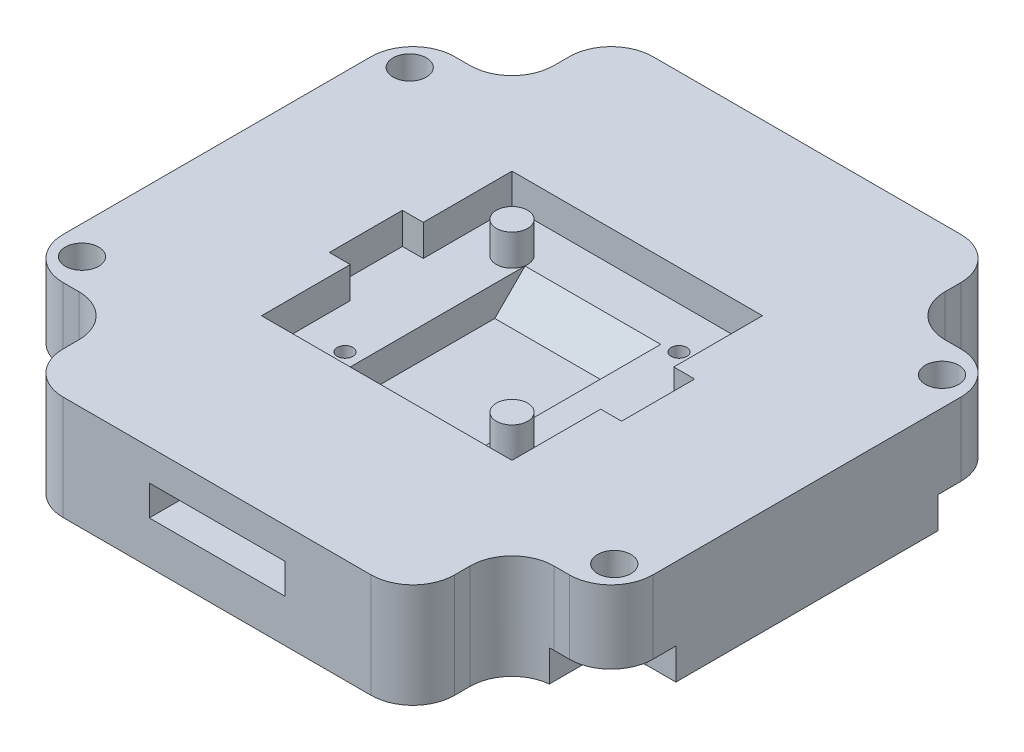
from build123d import *

# Parameters (mm, degrees)
AUFSATZ_LINEAR_AUSTRAGEN1_DEPTH      = 10
SKIZZE2_W                            = 24
SKIZZE2_H                            = 24
SCHNITT_LINEAR_AUSTRAGEN1_DEPTH      = 3
VERRUNDUNG1_R                        = 4
SKIZZE3_R                            = 1.5
AUFSATZ_LINEAR_AUSTRAGEN2_DEPTH      = 3
SKIZZE4_W                            = 2
SKIZZE4_H                            = 7
SCHNITT_LINEAR_AUSTRAGEN2_DEPTH      = 3
SKIZZE5_W                            = 13
SKIZZE5_H                            = 2.9
SCHNITT_LINEAR_AUSTRAGEN3_DEPTH      = 32
FASE1_SIZE                           = 4
F_3_2_3_2_DURCHMESSER_BOHRUNG1_D     = 3.2
F_3_2_3_2_DURCHMESSER_BOHRUNG1_DEPTH = 11
F_3_2_3_2_DURCHMESSER_BOHRUNG1_TIP   = 0.96137699
F_1_5_1_5_DURCHMESSER_BOHRUNG1_D     = 1.5
F_1_5_1_5_DURCHMESSER_BOHRUNG1_DEPTH = 5
F_1_5_1_5_DURCHMESSER_BOHRUNG1_TIP   = 0.450645464
SCHNITT_LINEAR_AUSTRAGEN4_DEPTH      = 3
SPIEGELN3_COPY_1_DEPTH               = 3


with BuildPart() as part:
    # Skizze1 → Aufsatz-Linear austragen1 (new body)
    with BuildSketch(Plane(origin=(0, 0, 0), x_dir=(1, 0, 0), z_dir=(0, 1, 0))):
        Polygon((18.75, 18.75), (28.25, 18.75), (28.25, -18.75), (18.75, -18.75), (18.75, -28.25), (-18.75, -28.25), (-18.75, -18.75), (-28.25, -18.75), (-28.25, 18.75), (-18.75, 18.75), (-18.75, 28.25), (18.75, 28.25), align=None)
    extrude(amount=AUFSATZ_LINEAR_AUSTRAGEN1_DEPTH)

    # Skizze2 → Schnitt-Linear austragen1 (cut)
    with BuildSketch(Plane(origin=(0, 10, 0), x_dir=(1, 0, 0), z_dir=(0, 1, 0))):
        Rectangle(SKIZZE2_W, SKIZZE2_H)
    extrude(amount=-SCHNITT_LINEAR_AUSTRAGEN1_DEPTH, mode=Mode.SUBTRACT)

    # Verrundung1
    verrundung1_edges = [part.edges().sort_by_distance(p)[0] for p in [
        (18.75, 5, 18.75),
        (18.75, 5, 28.25),
        (-18.75, 5, 28.25),
        (-18.75, 5, 18.75),
        (-28.25, 5, 18.75),
        (-28.25, 5, -18.75),
        (-18.75, 5, -18.75),
        (-18.75, 5, -28.25),
        (18.75, 5, -28.25),
        (18.75, 5, -18.75),
        (28.25, 5, -18.75),
        (28.25, 5, 18.75),
    ]]
    fillet(verrundung1_edges, radius=VERRUNDUNG1_R)

    # Skizze3 → Aufsatz-Linear austragen2 (add)
    with BuildSketch(Plane(origin=(0, 7, 0), x_dir=(1, 0, 0), z_dir=(0, 1, 0))):
        with Locations(Location((-8, 8, 0), (0, 0, 270))):
            Circle(SKIZZE3_R)
        with Locations(Location((8, -8, 0), (0, 0, 270))):
            Circle(SKIZZE3_R)
    extrude(amount=AUFSATZ_LINEAR_AUSTRAGEN2_DEPTH)

    # Skizze4 → Schnitt-Linear austragen2 (cut)
    with BuildSketch(Plane(origin=(0, 10, 0), x_dir=(1, 0, 0), z_dir=(0, 1, 0))):
        with Locations((13, 0)):
            Rectangle(SKIZZE4_W, SKIZZE4_H)
    schnitt_linear_austragen2 = extrude(amount=-SCHNITT_LINEAR_AUSTRAGEN2_DEPTH, mode=Mode.SUBTRACT)

    # Spiegeln1: Schnitt-Linear austragen2 across plane
    add(schnitt_linear_austragen2.mirror(Plane(origin=(0, 0, 0), x_dir=(0, 0, 1), z_dir=(1, 0, 0))), mode=Mode.SUBTRACT)

    # Skizze5 → Schnitt-Linear austragen3 (cut)
    with BuildSketch(Plane.XY.offset(28.25)):
        with Locations((0, 5.55)):
            Rectangle(SKIZZE5_W, SKIZZE5_H)
    extrude(amount=-SCHNITT_LINEAR_AUSTRAGEN3_DEPTH, mode=Mode.SUBTRACT)

    # Fase1
    # the kernel refuses this chamfer: 4 mm, written as the material it takes off along each edge
    with BuildSketch(Plane(origin=(-6.5, 7, -3.75), x_dir=(0, 0.027495876610586494, -0.9996219169112968), z_dir=(1, 0, 0))) as fase1_piece_1_section:
        Polygon((FASE1_SIZE * 0.999621916911, -FASE1_SIZE * 0.0274958766106), (-FASE1_SIZE * 0.0274958766106, -FASE1_SIZE * 0.999621916911), (0, 0), align=None)
    fase1_piece_1 = extrude(amount=13, mode=Mode.PRIVATE)
    fase1_piece_1 = split(fase1_piece_1, bisect_by=Plane(origin=(0, 4.1, -5.171489132), z_dir=(0, 1, 0)), keep=Keep.TOP, mode=Mode.PRIVATE)
    add(fase1_piece_1, mode=Mode.SUBTRACT)

    # Ø3.2 (3.2) Durchmesser Bohrung1
    with Locations(Plane(origin=(0, 10, 0), x_dir=(1, 0, 0), z_dir=(0, 1, 0))):
        with Locations((-25.5, -15.7), (25.5, 15.7), (25.5, -15.7), (-25.5, 15.7)):
            Hole(F_3_2_3_2_DURCHMESSER_BOHRUNG1_D / 2, depth=F_3_2_3_2_DURCHMESSER_BOHRUNG1_DEPTH)
            with Locations((0, 0, -(F_3_2_3_2_DURCHMESSER_BOHRUNG1_DEPTH + F_3_2_3_2_DURCHMESSER_BOHRUNG1_TIP / 2))):  # 118° drill point
                Cone(0, F_3_2_3_2_DURCHMESSER_BOHRUNG1_D / 2, F_3_2_3_2_DURCHMESSER_BOHRUNG1_TIP, mode=Mode.SUBTRACT)

    # Ø1.5 (1.5) Durchmesser Bohrung1
    with Locations(Plane(origin=(0, 7, 0), x_dir=(1, 0, 0), z_dir=(0, 1, 0))):
        with Locations((8, 8), (-8, -8)):
            Hole(F_1_5_1_5_DURCHMESSER_BOHRUNG1_D / 2, depth=F_1_5_1_5_DURCHMESSER_BOHRUNG1_DEPTH)
            with Locations((0, 0, -(F_1_5_1_5_DURCHMESSER_BOHRUNG1_DEPTH + F_1_5_1_5_DURCHMESSER_BOHRUNG1_TIP / 2))):  # 118° drill point
                Cone(0, F_1_5_1_5_DURCHMESSER_BOHRUNG1_D / 2, F_1_5_1_5_DURCHMESSER_BOHRUNG1_TIP, mode=Mode.SUBTRACT)

    # Skizze12 → Schnitt-Linear austragen4 (cut)
    with BuildSketch(Plane.XZ):
        with BuildLine():
            Line((-22.35, 15.7), (-22.35, 18.85))
            Line((-22.35, 18.85), (-25.5, 18.85))
            ThreePointArc((-25.5, 18.85), (-27.727386361, 17.927386361), (-28.65, 15.7))
            Line((-28.65, 15.7), (-28.65, 12.55))
            Line((-28.65, 12.55), (-25.5, 12.55))
            ThreePointArc((-25.5, 12.55), (-23.272613639, 13.472613639), (-22.35, 15.7))
        make_face()
    schnitt_linear_austragen4 = extrude(amount=-SCHNITT_LINEAR_AUSTRAGEN4_DEPTH, mode=Mode.SUBTRACT)

    # Spiegeln2: Schnitt-Linear austragen4 across plane
    add(schnitt_linear_austragen4.mirror(Plane(origin=(0, 0, 0), x_dir=(0, 0, 1), z_dir=(1, 0, 0))), mode=Mode.SUBTRACT)

    # Spiegeln3: Schnitt-Linear austragen4 across plane
    add(schnitt_linear_austragen4.mirror(Plane.XY), mode=Mode.SUBTRACT)

    # Spiegeln3 copy 1 sketch → Spiegeln3 copy 1 (cut)
    with BuildSketch(Plane(origin=(0, 0, 0), x_dir=(-1, 0, 0), z_dir=(0, -1, 0))):
        with BuildLine():
            Line((-22.35, 15.7), (-22.35, 18.85))
            Line((-22.35, 18.85), (-25.5, 18.85))
            ThreePointArc((-25.5, 18.85), (-27.727386361, 17.927386361), (-28.65, 15.7))
            Line((-28.65, 15.7), (-28.65, 12.55))
            Line((-28.65, 12.55), (-25.5, 12.55))
            ThreePointArc((-25.5, 12.55), (-23.272613639, 13.472613639), (-22.35, 15.7))
        make_face()
    extrude(amount=-SPIEGELN3_COPY_1_DEPTH, mode=Mode.SUBTRACT)


solid = part.part
